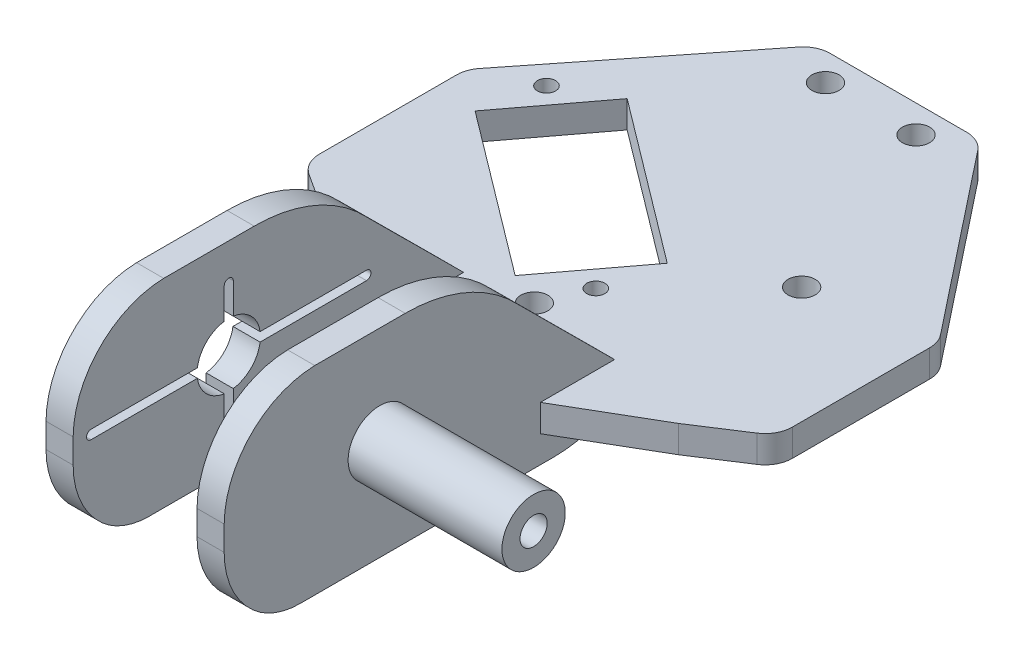
from build123d import *

# Parameters (mm, degrees)
SKETCH1_R           = 1.5
BOSS_EXTRUDE2_DEPTH = 3
BOSS_EXTRUDE3_DEPTH = 3
CUT_EXTRUDE2_DEPTH  = 3
SKETCH9_R           = 1
CUT_EXTRUDE3_DEPTH  = 10
SKETCH16_R          = 1.5
CUT_EXTRUDE4_DEPTH  = 10
SKETCH19_R          = 1.5
CUT_EXTRUDE6_DEPTH  = 10
SKETCH18_R          = 3.5
BOSS_EXTRUDE4_DEPTH = 20
SKETCH20_R          = 1.5
CUT_EXTRUDE7_DEPTH  = 12


with BuildPart() as part:
    # Sketch1 → Boss-Extrude2 (new body)
    with BuildSketch(Plane(origin=(0, 0, 0), x_dir=(1, 0, 0), z_dir=(0, 1, 0))):
        with BuildLine():
            Line((4.159514314, 37.595121312), (-4.159514314, 37.595121312))
            Line((-4.159514314, 37.595121312), (-7.549882818, 37.595121312))
            ThreePointArc((-7.549882818, 37.595121312), (-8.856700821, 37.295533634), (-9.902514443, 36.456605784))
            Line((-9.902514443, 36.456605784), (-18.853635092, 25.143758516))
            Line((-18.853635092, 25.143758516), (-20.315716636, 23.295911096))
            Line((-20.315716636, 23.295911096), (-25.482524908, 16.765855795))
            ThreePointArc((-25.482524908, 16.765855795), (-25.963433019, 15.889791317), (-26.129893283, 14.904371323))
            Line((-26.129893283, 14.904371323), (-26.129893283, -0.264323136))
            ThreePointArc((-26.129893283, -0.264323136), (-25.765831749, -1.696743606), (-24.76200768, -2.781504614))
            Line((-24.76200768, -2.781504614), (-19.713739782, -6.054749228))
            Line((-19.713739782, -6.054749228), (-19.472922353, -6.210892754))
            Line((-19.472922353, -6.210892754), (-9.845245803, -11.818200299))
            Line((-9.845245803, -11.818200299), (-9.845245803, -21.818200299))
            Line((-9.845245803, -21.818200299), (-6.845245803, -21.818200299))
            Line((-6.845245803, -21.818200299), (-6.845245803, -12.43052246))
            Line((-6.845245803, -12.43052246), (6.845245803, -12.43052246))
            Line((6.845245803, -12.43052246), (6.845245803, -21.818200299))
            Line((6.845245803, -21.818200299), (9.845245803, -21.818200299))
            Line((9.845245803, -21.818200299), (9.845245803, -11.818200299))
            Line((9.845245803, -11.818200299), (19.472922353, -6.210892754))
            Line((19.472922353, -6.210892754), (19.713739782, -6.054749228))
            Line((19.713739782, -6.054749228), (24.76200768, -2.781504614))
            ThreePointArc((24.76200768, -2.781504614), (25.765831749, -1.696743606), (26.129893283, -0.264323136))
            Line((26.129893283, -0.264323136), (26.129893283, 14.904371323))
            ThreePointArc((26.129893283, 14.904371323), (25.963433019, 15.889791317), (25.482524908, 16.765855795))
            Line((25.482524908, 16.765855795), (20.315716636, 23.295911096))
            Line((20.315716636, 23.295911096), (18.853635092, 25.143758516))
            Line((18.853635092, 25.143758516), (9.902514443, 36.456605784))
            ThreePointArc((9.902514443, 36.456605784), (8.856700821, 37.295533634), (7.549882818, 37.595121312))
            Line((7.549882818, 37.595121312), (4.297592614, 37.595121312))
            Line((4.297592614, 37.595121312), (4.159514314, 37.595121312))
        make_face()
        with Locations((-5.001681115, 34.535904251)):
            Circle(SKETCH1_R, mode=Mode.SUBTRACT)
        with Locations((5.001681115, 34.535904251)):
            Circle(SKETCH1_R, mode=Mode.SUBTRACT)
    boss_extrude2 = extrude(amount=BOSS_EXTRUDE2_DEPTH)

    # Mirror1: Boss-Extrude2 across plane
    add(boss_extrude2.mirror(Plane(origin=(0, 0, 0), x_dir=(0, 0, 1), z_dir=(1, 0, 0))))

    # Sketch3 → Boss-Extrude3 (add)
    with BuildSketch(Plane(origin=(9.845245803, 0, 0), x_dir=(0, 0, -1), z_dir=(1, 0, 0))):
        with BuildLine():
            Line((0, 0), (-5.421352116, -2.066157894))
            ThreePointArc((-5.421352116, -2.066157894), (-7.850185569, -2.74644586), (-10.362047471, -2.975734863))
            Line((-10.362047471, -2.975734863), (-38.362047471, -2.975734863))
            ThreePointArc((-38.362047471, -2.975734863), (-41.134396036, -2.468883109), (-43.548074422, -1.013901351))
            ThreePointArc((-43.548074422, -1.013901351), (-45.923317218, 2.205664871), (-46.764673565, 6.117122974))
            Line((-46.764673565, 6.117122974), (-46.764673565, 8.824758711))
            ThreePointArc((-46.764673565, 8.824758711), (-43.812873151, 15.930413437), (-36.754866074, 18.994396283))
            Line((-36.754866074, 18.994396283), (-26.754866074, 18.994396283))
            ThreePointArc((-26.754866074, 18.994396283), (-19.981920665, 17.598328696), (-14.313116387, 13.637716084))
            Line((-14.313116387, 13.637716084), (-3.618521022, 3))
            Line((-3.618521022, 3), (0, 0))
        make_face()
    boss_extrude3 = extrude(amount=-BOSS_EXTRUDE3_DEPTH)

    # Mirror2: Boss-Extrude3 across plane
    add(boss_extrude3.mirror(Plane(origin=(0, 0, 0), x_dir=(0, 0, 1), z_dir=(1, 0, 0))))

    # Sketch5 → Cut-Extrude2 (cut)
    with BuildSketch(Plane.ZY.offset(9.845245803)):
        with BuildLine():
            Line((26.104098684, 8.568437952), (14.348200299, 8.568437952))
            ThreePointArc((14.348200299, 8.568437952), (13.848200299, 8.068437952), (14.348200299, 7.568437952))
            Line((14.348200299, 7.568437952), (26.104098684, 7.568437952))
            ThreePointArc((26.104098684, 7.568437952), (27.093326565, 5.593564218), (29.068200299, 4.604336337))
            Line((29.068200299, 4.604336337), (29.068200299, 1.213437952))
            ThreePointArc((29.068200299, 1.213437952), (29.568200299, 0.713437952), (30.068200299, 1.213437952))
            Line((30.068200299, 1.213437952), (30.068200299, 4.604336337))
            ThreePointArc((30.068200299, 4.604336337), (32.043074033, 5.593564218), (33.032301914, 7.568437952))
            Line((33.032301914, 7.568437952), (44.788200299, 7.568437952))
            ThreePointArc((44.788200299, 7.568437952), (45.288200299, 8.068437952), (44.788200299, 8.568437952))
            Line((44.788200299, 8.568437952), (33.032301914, 8.568437952))
            ThreePointArc((33.032301914, 8.568437952), (32.043074033, 10.543311686), (30.068200299, 11.532539567))
            Line((30.068200299, 11.532539567), (30.068200299, 14.923437952))
            ThreePointArc((30.068200299, 14.923437952), (29.568200299, 15.423437952), (29.068200299, 14.923437952))
            Line((29.068200299, 14.923437952), (29.068200299, 11.532539567))
            ThreePointArc((29.068200299, 11.532539567), (27.093326565, 10.543311686), (26.104098684, 8.568437952))
        make_face()
    extrude(amount=-CUT_EXTRUDE2_DEPTH, mode=Mode.SUBTRACT)

    # Sketch9 → Cut-Extrude3 (cut)
    with BuildSketch(Plane(origin=(0, 3, 0), x_dir=(1, 0, 0), z_dir=(0, 1, 0))):
        Polygon((-3.685085338, -1.07663963), (3.53669494, 8.50698649), (-14.432604036, 22.047824511), (-21.654384314, 12.464198391), align=None)
        with Locations((2.002257127, 2.15045437)):
            Circle(SKETCH9_R)
        with Locations((-20.119946501, 18.820730511)):
            Circle(SKETCH9_R)
    extrude(amount=-CUT_EXTRUDE3_DEPTH, mode=Mode.SUBTRACT)

    # Sketch16 → Cut-Extrude4 (cut)
    with BuildSketch(Plane(origin=(0, 3, 0), x_dir=(1, 0, 0), z_dir=(0, 1, 0))):
        with Locations((13.251681115, 13.645904251)):
            Circle(SKETCH16_R)
    extrude(amount=-CUT_EXTRUDE4_DEPTH, mode=Mode.SUBTRACT)

    # Sketch19 → Cut-Extrude6 (cut)
    with BuildSketch(Plane(origin=(0, 3, 0), x_dir=(1, 0, 0), z_dir=(0, 1, 0))):
        with Locations((0, -2.642994386)):
            Circle(SKETCH19_R)
    extrude(amount=-CUT_EXTRUDE6_DEPTH, mode=Mode.SUBTRACT)

    # Sketch18 → Boss-Extrude4 (add)
    with BuildSketch(Plane.ZY.offset(-6.845245803)):
        with Locations((29.568200299, 8.068437952)):
            Circle(SKETCH18_R)
    extrude(amount=-BOSS_EXTRUDE4_DEPTH)

    # Sketch20 → Cut-Extrude7 (cut)
    with BuildSketch(Plane(origin=(26.845245803, 0, 0), x_dir=(0, 0, -1), z_dir=(1, 0, 0))):
        with Locations((-29.568200299, 8.068437952)):
            Circle(SKETCH20_R)
    extrude(amount=-CUT_EXTRUDE7_DEPTH, mode=Mode.SUBTRACT)


solid = part.part
